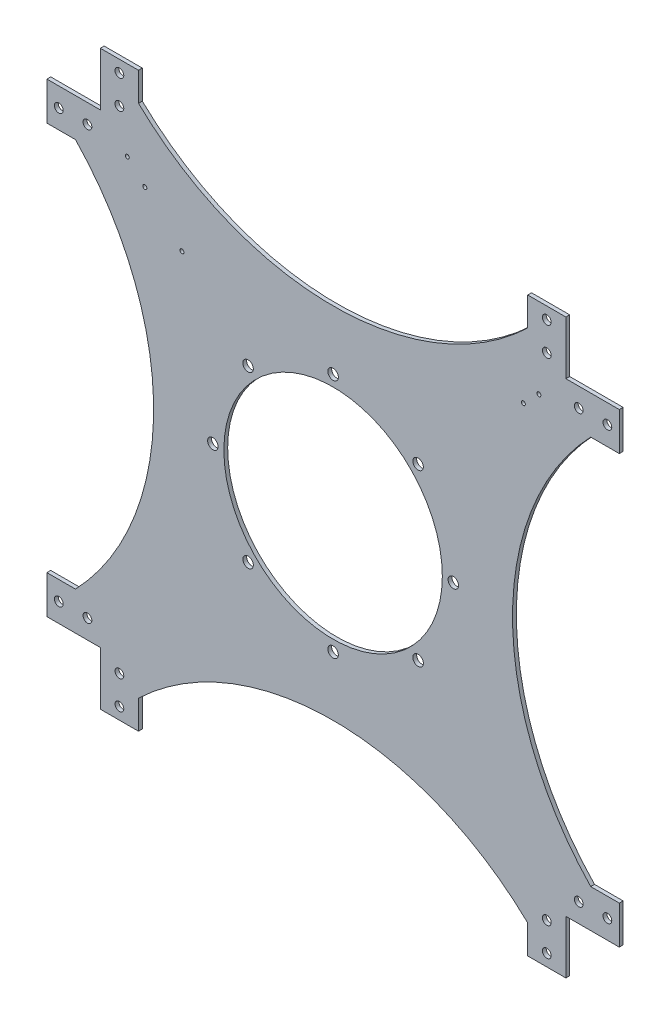
from build123d import *

# Parameters (mm, degrees)
SKETCH1_R          = 114.5
BASE_FLANGE1_DEPTH = 4
SKETCH2_R          = 4.6
EXTRUDE1_DEPTH     = 4
SKETCH3_R          = 5.5
EXTRUDE2_DEPTH     = 4
CIRPATTERN1_COUNT  = 8
SKETCH4_R          = 2.1
CUT_EXTRUDE1_DEPTH = 10


# Sheet-metal steps are written as plain solids
with BuildPart() as part:
    # Sketch1 → Base-Flange1 (new body)
    with BuildSketch(Plane.XY):
        with BuildLine():
            Line((244, 244), (244, 300))
            Line((244, 300), (204, 300))
            Line((204, 300), (204, 270))
            ThreePointArc((204, 270), (0, 188.093876027), (-204, 270))
            Line((-204, 270), (-204, 300))
            Line((-204, 300), (-244, 300))
            Line((-244, 300), (-244, 244))
            Line((-244, 244), (-300, 244))
            Line((-300, 244), (-300, 204))
            Line((-300, 204), (-270, 204))
            ThreePointArc((-270, 204), (-188.093876027, 0), (-270, -204))
            Line((-270, -204), (-300, -204))
            Line((-300, -204), (-300, -244))
            Line((-300, -244), (-244, -244))
            Line((-244, -244), (-244, -300))
            Line((-244, -300), (-204, -300))
            Line((-204, -300), (-204, -270))
            ThreePointArc((-204, -270), (0, -188.093876027), (204, -270))
            Line((204, -270), (204, -300))
            Line((204, -300), (244, -300))
            Line((244, -300), (244, -244))
            Line((244, -244), (300, -244))
            Line((300, -244), (300, -204))
            Line((300, -204), (270, -204))
            ThreePointArc((270, -204), (188.093876027, 0), (270, 204))
            Line((270, 204), (300, 204))
            Line((300, 204), (300, 244))
            Line((300, 244), (244, 244))
        make_face()
        Circle(SKETCH1_R, mode=Mode.SUBTRACT)
    extrude(amount=BASE_FLANGE1_DEPTH)

    # Sketch2 → Extrude1 (cut)
    with BuildSketch(Plane.XY.offset(4)):
        with Locations((224, 287.5)):
            Circle(SKETCH2_R)
        with Locations((224, 257.5)):
            Circle(SKETCH2_R)
        with Locations((257.5, 224)):
            Circle(SKETCH2_R)
        with Locations((287.5, 224)):
            Circle(SKETCH2_R)
        with Locations(Location((287.5, -224, 0), (0, 0, 180))):
            Circle(SKETCH2_R)
        with Locations(Location((257.5, -224, 0), (0, 0, 180))):
            Circle(SKETCH2_R)
        with Locations(Location((224, -257.5, 0), (0, 0, 180))):
            Circle(SKETCH2_R)
        with Locations(Location((224, -287.5, 0), (0, 0, 180))):
            Circle(SKETCH2_R)
        with Locations((-224, -287.5)):
            Circle(SKETCH2_R)
        with Locations((-224, -257.5)):
            Circle(SKETCH2_R)
        with Locations((-257.5, -224)):
            Circle(SKETCH2_R)
        with Locations((-287.5, -224)):
            Circle(SKETCH2_R)
        with Locations(Location((-287.5, 224, 0), (0, 0, 180))):
            Circle(SKETCH2_R)
        with Locations(Location((-257.5, 224, 0), (0, 0, 180))):
            Circle(SKETCH2_R)
        with Locations(Location((-224, 257.5, 0), (0, 0, 180))):
            Circle(SKETCH2_R)
        with Locations(Location((-224, 287.5, 0), (0, 0, 180))):
            Circle(SKETCH2_R)
    extrude(amount=-EXTRUDE1_DEPTH, mode=Mode.SUBTRACT)

    # Sketch3 → Extrude2 (cut)
    with BuildSketch(Plane.XY.offset(4)):
        with Locations((0, 126)):
            Circle(SKETCH3_R)
    extrude2 = extrude(amount=-EXTRUDE2_DEPTH, mode=Mode.SUBTRACT)

    # CirPattern1: Extrude2 ×8 about axis
    cirpattern1_axis = Axis((0, 0, 0), (0, 0, 1))
    for i in range(1, CIRPATTERN1_COUNT):
        add(extrude2.rotate(cirpattern1_axis, i * 360 / CIRPATTERN1_COUNT), mode=Mode.SUBTRACT)

    # Sketch4 → Cut-Extrude1 (cut)
    with BuildSketch(Plane.XY.offset(4)):
        with Locations((215.715728753, 215.715728753)):
            Circle(SKETCH4_R)
        with Locations((199.452272785, 199.452272785)):
            Circle(SKETCH4_R)
        with Locations((-158.440079476, 158.440079476)):
            Circle(SKETCH4_R)
        with Locations((-215.715728753, 215.715728753)):
            Circle(SKETCH4_R)
        with Locations((-197.330952442, 197.330952442)):
            Circle(SKETCH4_R)
    extrude(amount=-CUT_EXTRUDE1_DEPTH, mode=Mode.SUBTRACT)


solid = part.part
